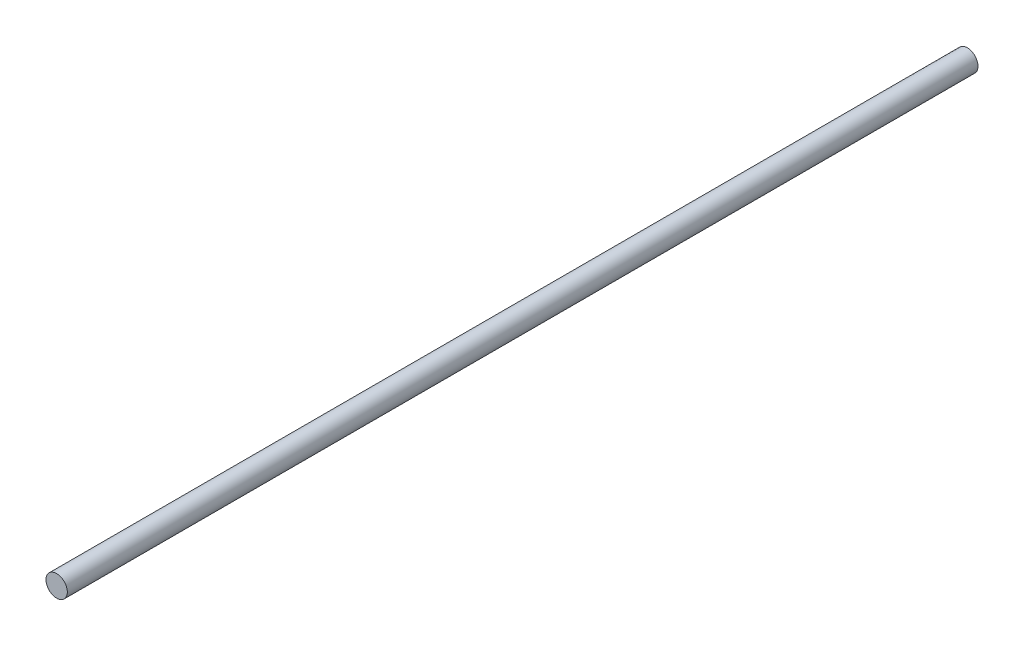
from build123d import *

# Parameters (mm, degrees)
SKETCH1_R           = 4.3
BOSS_EXTRUDE1_DEPTH = 367


with BuildPart() as part:
    # Sketch1 → Boss-Extrude1 (new body)
    with BuildSketch(Plane.XY):
        Circle(SKETCH1_R)
    extrude(amount=BOSS_EXTRUDE1_DEPTH)


solid = part.part
